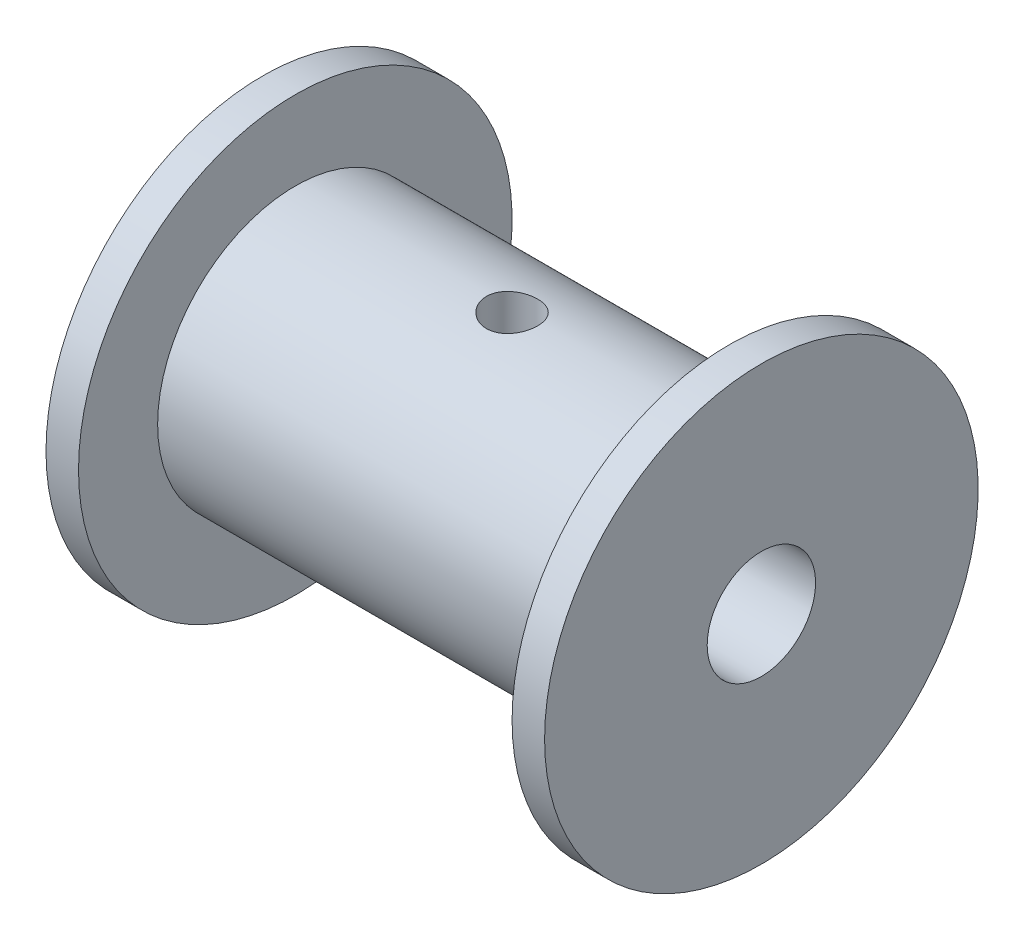
from build123d import *

# Parameters (mm, degrees)
SKETCH2_R          = 1.5
CUT_EXTRUDE1_DEPTH = 24.14921219


with BuildPart() as part:
    # Sketch1 → Revolve1 (revolve)
    with BuildSketch(Plane.XY):
        Polygon((14.605, 3.175), (14.605, 12.7), (12.7, 12.7), (12.7, 8.0645), (-12.7, 8.0645), (-12.7, 12.7), (-14.605, 12.7), (-14.605, 3.175), align=None)
    revolve(axis=Axis((-15.275524476, 0, 0), (1, 0, 0)))

    # Sketch2 → Cut-Extrude1 (cut, through all)
    with BuildSketch(Plane(origin=(0, 0, 0), x_dir=(1, 0, 0), z_dir=(0, 1, 0))):
        Circle(SKETCH2_R)
    extrude(amount=CUT_EXTRUDE1_DEPTH, mode=Mode.SUBTRACT)


solid = part.part
